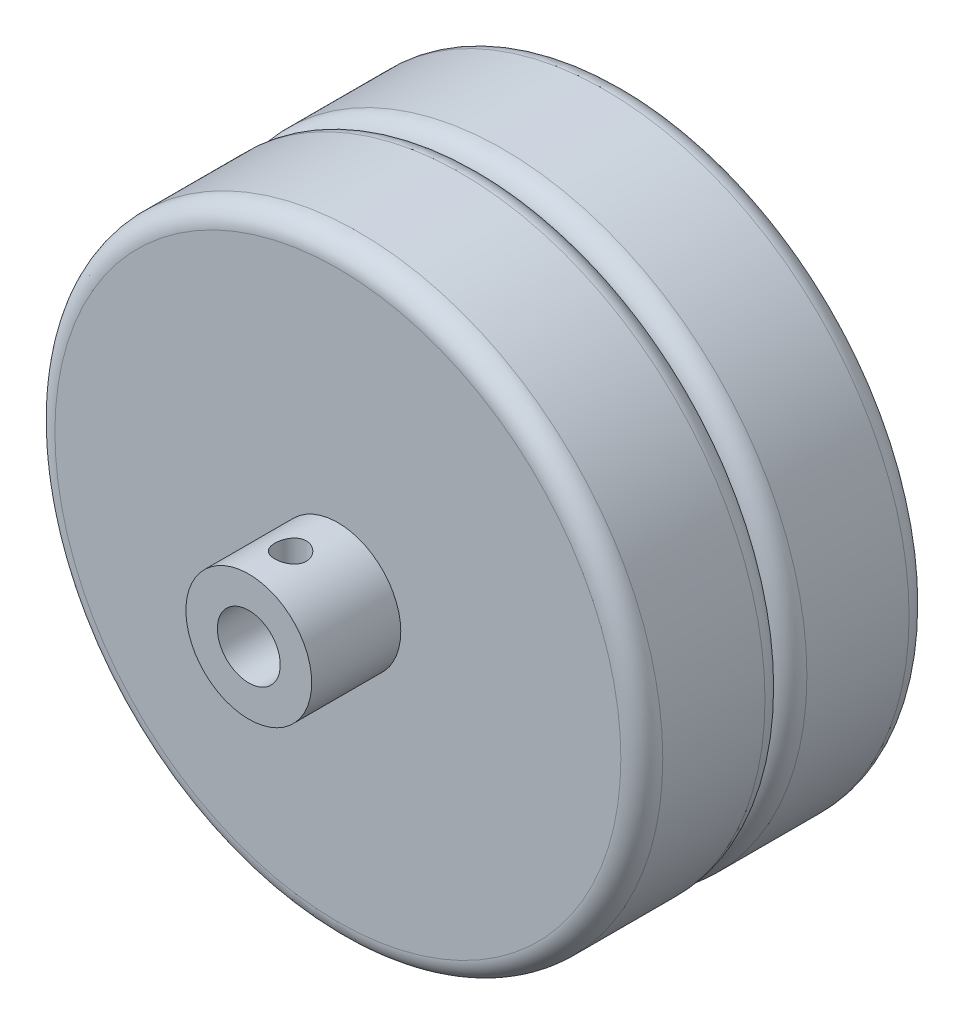
from build123d import *

# Parameters (mm, degrees)
SKETCH_1_R          = 29
EXTRUDE_1_DEPTH     = 13.75
FILLET_1_R          = 2
FILLET_2_R          = 2
SKETCH_2_R          = 29
EXTRUDE_2_DEPTH     = 13.75
FILLET_3_R          = 2
SKETCH_4_R          = 6
CUT_EXTRUDE_1_DEPTH = 24
SKETCH_10_R         = 6
SKETCH_10_R_2       = 3
EXTRUDE_3_DEPTH     = 8.5
SKETCH_11_R         = 1.5
CUT_EXTRUDE_2_DEPTH = 5


with BuildPart() as part:
    # 草图1 → 凸台-拉伸1 (new body)
    with BuildSketch(Plane.XY):
        Circle(SKETCH_1_R)
    extrude(amount=EXTRUDE_1_DEPTH)

    # 圆角1
    fillet_1_edges = [part.edges().sort_by_distance(p)[0] for p in [
        (-29, 0, 13.75),
    ]]
    fillet(fillet_1_edges, radius=FILLET_1_R)

    # 圆角2
    fillet_2_edges = [part.edges().sort_by_distance(p)[0] for p in [
        (-29, 0, 0),
    ]]
    fillet(fillet_2_edges, radius=FILLET_2_R)

    # 草图2 → 凸台-拉伸2 (add)
    with BuildSketch(Plane.XY.offset(13.75)):
        Circle(SKETCH_2_R)
    extrude(amount=EXTRUDE_2_DEPTH)

    # 圆角3
    fillet_3_edges = [part.edges().sort_by_distance(p)[0] for p in [
        (-29, 0, 13.75),
        (-29, 0, 27.5),
    ]]
    fillet(fillet_3_edges, radius=FILLET_3_R - 0.0001)  # a hair under: the kernel refuses the full size

    # 草图4 → 切除-拉伸1 (cut)
    with BuildSketch(Plane.XY.offset(27.5)):
        Circle(SKETCH_4_R)
    extrude(amount=-CUT_EXTRUDE_1_DEPTH, mode=Mode.SUBTRACT)


with BuildPart() as body_2:
    # 草图10 → 凸台-拉伸3 (new body)
    with BuildSketch(Plane.XY.offset(27.5)):
        Circle(SKETCH_10_R)
        Circle(SKETCH_10_R_2, mode=Mode.SUBTRACT)
    extrude(amount=EXTRUDE_3_DEPTH)

    # 草图11 → 切除-拉伸2 (cut)
    with BuildSketch(Plane(origin=(0, 6, 0), x_dir=(1, 0, 0), z_dir=(0, 1, 0))):
        with Locations(Location((0, -32.015019556, 0), (0, 0, 270))):
            Circle(SKETCH_11_R)
    extrude(amount=-CUT_EXTRUDE_2_DEPTH, mode=Mode.SUBTRACT)


solid = Compound([part.part, body_2.part])
